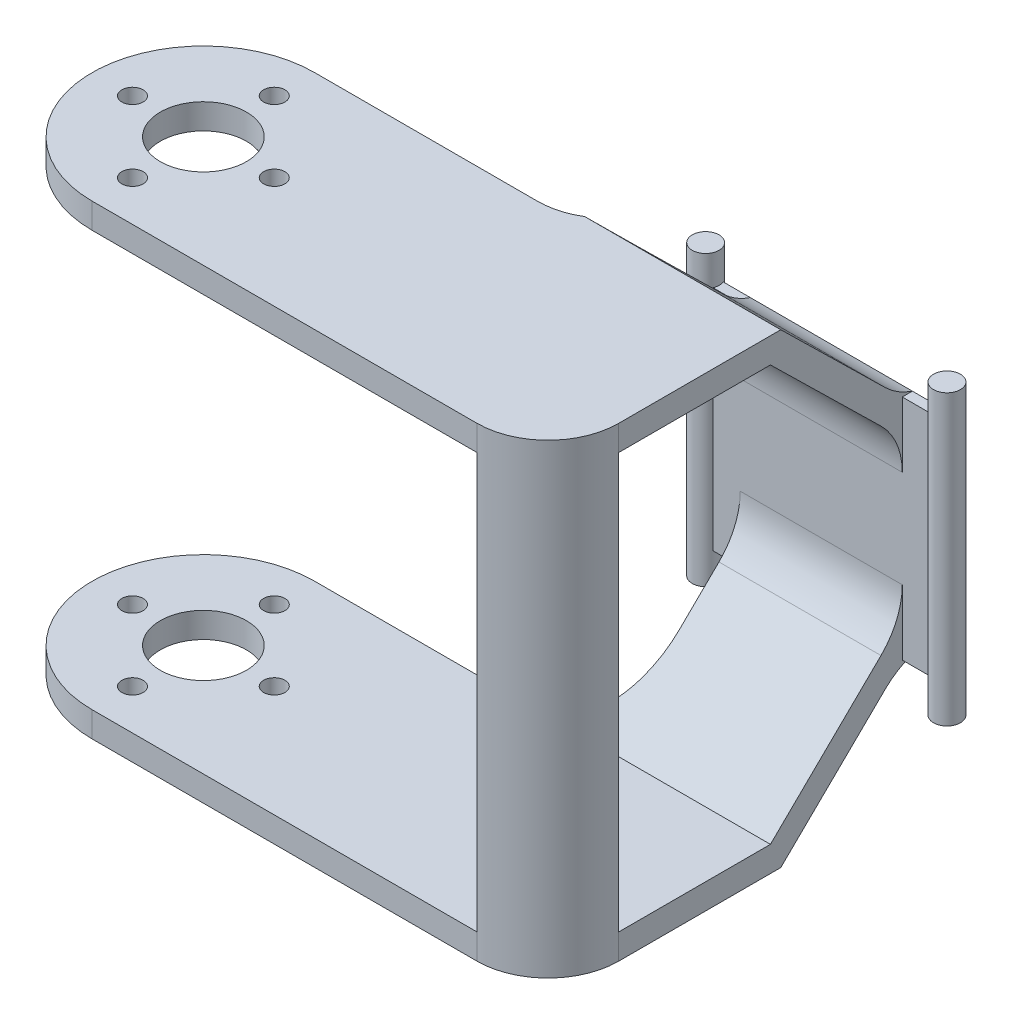
from build123d import *

# Parameters (mm, degrees)
SKETCH1_W           = 23.83
SKETCH1_H           = 1
BOSS_EXTRUDE1_DEPTH = 22.5
SKETCH2_R           = 1.325
BOSS_EXTRUDE2_DEPTH = 14.25
BOSS_EXTRUDE4_DEPTH = 8
SKETCH5_W           = 21.979847568
SKETCH5_H           = 2.5
BOSS_EXTRUDE5_DEPTH = 40
SKETCH6_R           = 4.25
SKETCH6_R_2         = 1.05
CUT_EXTRUDE1_DEPTH  = 76.367433285
FILLET1_R           = 7
FILLET2_R           = 7
FILLET3_R           = 7
BOSS_EXTRUDE6_START = 41
BOSS_EXTRUDE6_DEPTH = 41


with BuildPart() as part:
    # Sketch1 → Boss-Extrude1 (new body)
    with BuildSketch(Plane(origin=(0, 0, 0), x_dir=(1, 0, 0), z_dir=(0, 1, 0))):
        Rectangle(SKETCH1_W, SKETCH1_H)
    extrude(amount=BOSS_EXTRUDE1_DEPTH)

    # Sketch2 → Boss-Extrude2 (add, symmetric)
    with BuildSketch(Plane(origin=(0, 11.25, 0), x_dir=(1, 0, 0), z_dir=(0, 1, 0))):
        with Locations(Location((-11.915, 0, 0), (0, 0, 270))):
            Circle(SKETCH2_R)
        with Locations(Location((11.915, 0, 0), (0, 0, 270))):
            Circle(SKETCH2_R)
    extrude(amount=BOSS_EXTRUDE2_DEPTH, both=True)

    # Sketch4 → Boss-Extrude4 (add, symmetric)
    with BuildSketch(Plane(origin=(0, 0, 0), x_dir=(0, 0, -1), z_dir=(1, 0, 0))):
        Polygon((-0.5, 19.001100744), (-0.5, 22.5), (-12.5, 34.25), (-35.5, 34.25), (-35.5, 31.75), (-13.520152432, 31.75), align=None)
        Polygon((-0.5, 0), (-0.5, 3.498899256), (-13.520152432, -9.25), (-35.5, -9.25), (-35.5, -11.75), (-12.5, -11.75), align=None)
    extrude(amount=BOSS_EXTRUDE4_DEPTH, both=True)

    # Sketch5 → Boss-Extrude5 (add)
    with BuildSketch(Plane.ZY.offset(8)):
        with Locations((24.510076216, 33)):
            Rectangle(SKETCH5_W, SKETCH5_H)
        with Locations((24.510076216, -10.5)):
            Rectangle(SKETCH5_W, SKETCH5_H)
    extrude(amount=BOSS_EXTRUDE5_DEPTH)

    # Sketch6 → Cut-Extrude1 (cut, through all)
    with BuildSketch(Plane(origin=(0, 34.25, 0), x_dir=(1, 0, 0), z_dir=(0, 1, 0))):
        with Locations(Location((-37.010076216, -24.510076216, 0), (0, 0, 270))):
            Circle(SKETCH6_R)
        with Locations(Location((-44.010076216, -24.510076216, 0), (0, 0, 270))):
            Circle(SKETCH6_R_2)
        with Locations(Location((-37.010076216, -17.510076216, 0), (0, 0, 270))):
            Circle(SKETCH6_R_2)
        with Locations(Location((-30.010076216, -24.510076216, 0), (0, 0, 270))):
            Circle(SKETCH6_R_2)
        with Locations(Location((-37.010076216, -31.510076216, 0), (0, 0, 270))):
            Circle(SKETCH6_R_2)
        with BuildLine():
            ThreePointArc((-48, -24.510076216), (-44.781125848, -16.739026584), (-37.010076216, -13.520152432))
            Line((-37.010076216, -13.520152432), (-48, -13.520152432))
            Line((-48, -13.520152432), (-48, -24.510076216))
        make_face()
        with BuildLine():
            ThreePointArc((-37.010076216, -35.5), (-44.781125848, -32.281125848), (-48, -24.510076216))
            Line((-48, -24.510076216), (-48, -35.5))
            Line((-48, -35.5), (-37.010076216, -35.5))
        make_face()
    extrude(amount=-CUT_EXTRUDE1_DEPTH, mode=Mode.SUBTRACT)

    # Fillet1
    # the kernel refuses this fillet: 7 mm, written as the material it adds along each edge
    with BuildSketch(Plane(origin=(-8, -11.75, 13.520152432), x_dir=(-1, 0, 0), z_dir=(0, 1, 0))) as fillet1_piece_1_section:
        with BuildLine():
            CenterArc((FILLET1_R, -FILLET1_R), FILLET1_R, 90, 90)
            Line((0, -FILLET1_R), (0, 0))
            Line((0, 0), (FILLET1_R, 0))
        make_face()
    fillet1_piece_1 = extrude(amount=2.5, mode=Mode.PRIVATE)
    fillet1_piece_1 = split(fillet1_piece_1, bisect_by=Plane(origin=(-10.011124011, -11.168341556, 11.905965844), z_dir=(0, 0.7145104264934944, 0.699624792608213)), keep=Keep.TOP, mode=Mode.PRIVATE)
    fillet1_piece_1 = split(fillet1_piece_1, bisect_by=Plane(origin=(-10.011124011, -9.382065489, 13.655027826), z_dir=(0, -0.7145104264934944, -0.6996247926082129)), keep=Keep.TOP, mode=Mode.PRIVATE)
    add(fillet1_piece_1)
    with BuildSketch(Plane(origin=(-8, -11.75, 13.520152432), x_dir=(-1, 0, 0), z_dir=(0, 1, 0))) as fillet1_piece_2_section:
        with BuildLine():
            CenterArc((FILLET1_R, -FILLET1_R), FILLET1_R, 90, 90)
            Line((0, -FILLET1_R), (0, 0))
            Line((0, 0), (FILLET1_R, 0))
        make_face()
    fillet1_piece_2 = extrude(amount=20, mode=Mode.PRIVATE)
    fillet1_piece_2 = split(fillet1_piece_2, bisect_by=Plane(origin=(-8.808469458, -8.892227761, 9.581424097), z_dir=(0, 0.7145104264934944, 0.699624792608213)), keep=Keep.TOP, mode=Mode.PRIVATE)
    fillet1_piece_2 = split(fillet1_piece_2, bisect_by=Plane(origin=(-8.808469458, -9.25, 10.72673952), z_dir=(0, 1, 0)), keep=Keep.TOP, mode=Mode.PRIVATE)
    fillet1_piece_2 = split(fillet1_piece_2, bisect_by=Plane(origin=(-8.808469458, -7.105951695, 11.330486078), z_dir=(0, -0.7145104264934944, -0.6996247926082129)), keep=Keep.TOP, mode=Mode.PRIVATE)
    add(fillet1_piece_2)
    with BuildSketch(Plane(origin=(-8, 34.25, 13.520152432), x_dir=(0, 0, -1), z_dir=(0, -1, 0))) as fillet1_piece_3_section:
        with BuildLine():
            CenterArc((FILLET1_R, -FILLET1_R), FILLET1_R, 90, 90)
            Line((0, -FILLET1_R), (0, 0))
            Line((0, 0), (FILLET1_R, 0))
        make_face()
    fillet1_piece_3 = extrude(amount=2.5, mode=Mode.PRIVATE)
    fillet1_piece_3 = split(fillet1_piece_3, bisect_by=Plane(origin=(-10.011124011, 31.882065489, 13.655027826), z_dir=(0, 0.7145104264934944, -0.6996247926082129)), keep=Keep.TOP, mode=Mode.PRIVATE)
    fillet1_piece_3 = split(fillet1_piece_3, bisect_by=Plane(origin=(-10.011124011, 33.668341556, 11.905965844), z_dir=(0, -0.7145104264934944, 0.699624792608213)), keep=Keep.TOP, mode=Mode.PRIVATE)
    add(fillet1_piece_3)
    with BuildSketch(Plane(origin=(-8, 34.25, 13.520152432), x_dir=(0, 0, -1), z_dir=(0, -1, 0))) as fillet1_piece_4_section:
        with BuildLine():
            CenterArc((FILLET1_R, -FILLET1_R), FILLET1_R, 90, 90)
            Line((0, -FILLET1_R), (0, 0))
            Line((0, 0), (FILLET1_R, 0))
        make_face()
    fillet1_piece_4 = extrude(amount=20, mode=Mode.PRIVATE)
    fillet1_piece_4 = split(fillet1_piece_4, bisect_by=Plane(origin=(-8.808469465, 29.605951697, 11.33048608), z_dir=(0, 0.7145104264934944, -0.6996247926082129)), keep=Keep.TOP, mode=Mode.PRIVATE)
    fillet1_piece_4 = split(fillet1_piece_4, bisect_by=Plane(origin=(-8.808469465, 31.392227764, 9.581424099), z_dir=(0, -0.7145104264934944, 0.699624792608213)), keep=Keep.TOP, mode=Mode.PRIVATE)
    fillet1_piece_4 = split(fillet1_piece_4, bisect_by=Plane(origin=(-8.808469465, 31.75, 10.726739522), z_dir=(0, -1, 0)), keep=Keep.TOP, mode=Mode.PRIVATE)
    add(fillet1_piece_4)
    # the kernel refuses this fillet: 7 mm, written as the material it takes off along each edge
    with BuildSketch(Plane(origin=(8, 8.25, 35.5), x_dir=(0, 0, -1), z_dir=(0, -1, 0))) as fillet1_2_piece_1:
        with BuildLine():
            CenterArc((FILLET1_R, -FILLET1_R), FILLET1_R, 90, 90)
            Line((0, -FILLET1_R), (0, 0))
            Line((0, 0), (FILLET1_R, 0))
        make_face()
    extrude(amount=37.5, mode=Mode.SUBTRACT)
    with BuildSketch(Plane(origin=(8, 51.75, 35.5), x_dir=(-1, 0, 0), z_dir=(0, -1, 0))) as fillet1_2_piece_2:
        with BuildLine():
            CenterArc((FILLET1_R, FILLET1_R), FILLET1_R, 180, 90)
            Line((0, FILLET1_R), (0, 0))
            Line((0, 0), (FILLET1_R, 0))
        make_face()
    extrude(amount=37.5, mode=Mode.SUBTRACT)

    # Fillet2
    fillet2_edges = [part.edges().sort_by_distance(p)[0] for p in [
        (0, 19.001100744, 0.5),
        (0, 3.498899256, 0.5),
    ]]
    fillet(fillet2_edges, radius=FILLET2_R)

    # Fillet3
    # the kernel refuses this fillet: 7 mm, written as the material it adds along each edge
    with BuildSketch(Plane(origin=(-8, 22.5, 0.5), x_dir=(0, 0.6996247926074847, 0.7145104264942074), z_dir=(1, 0, 0))) as fillet3_piece_1:
        with BuildLine():
            CenterArc((2.335944006, -7), FILLET3_R, 90, 25.834886249)
            Line((-0.714510426, -0.699624793), (0, 0))
            Line((0, 0), (2.335944006, 0))
        make_face()
    extrude(amount=16)
    with BuildSketch(Plane(origin=(8, 0, 0.5), x_dir=(0, 0, -1), z_dir=(-1, 0, 0))) as fillet3_piece_2:
        with BuildLine():
            CenterArc((3.2283172, 6.635857326), FILLET3_R, 225.603091194, 25.834886249)
            Line((-1.669056348, 1.634284341), (0, 0))
            Line((0, 0), (1, 0))
        make_face()
    extrude(amount=16)

    # Sketch8 → Boss-Extrude6 (add)
    with BuildSketch(Plane(origin=(0, -9.25, 0), x_dir=(1, 0, 0), z_dir=(0, 1, 0)).offset(BOSS_EXTRUDE6_START)):
        with BuildLine():
            ThreePointArc((1, -35.5), (5.949747468, -33.449747468), (8, -28.5))
            Line((8, -28.5), (5, -28.5))
            ThreePointArc((5, -28.5), (3.422054899, -30.922054899), (1, -32.5))
            Line((1, -32.5), (1, -35.5))
        make_face()
    extrude(amount=-BOSS_EXTRUDE6_DEPTH)


solid = part.part
